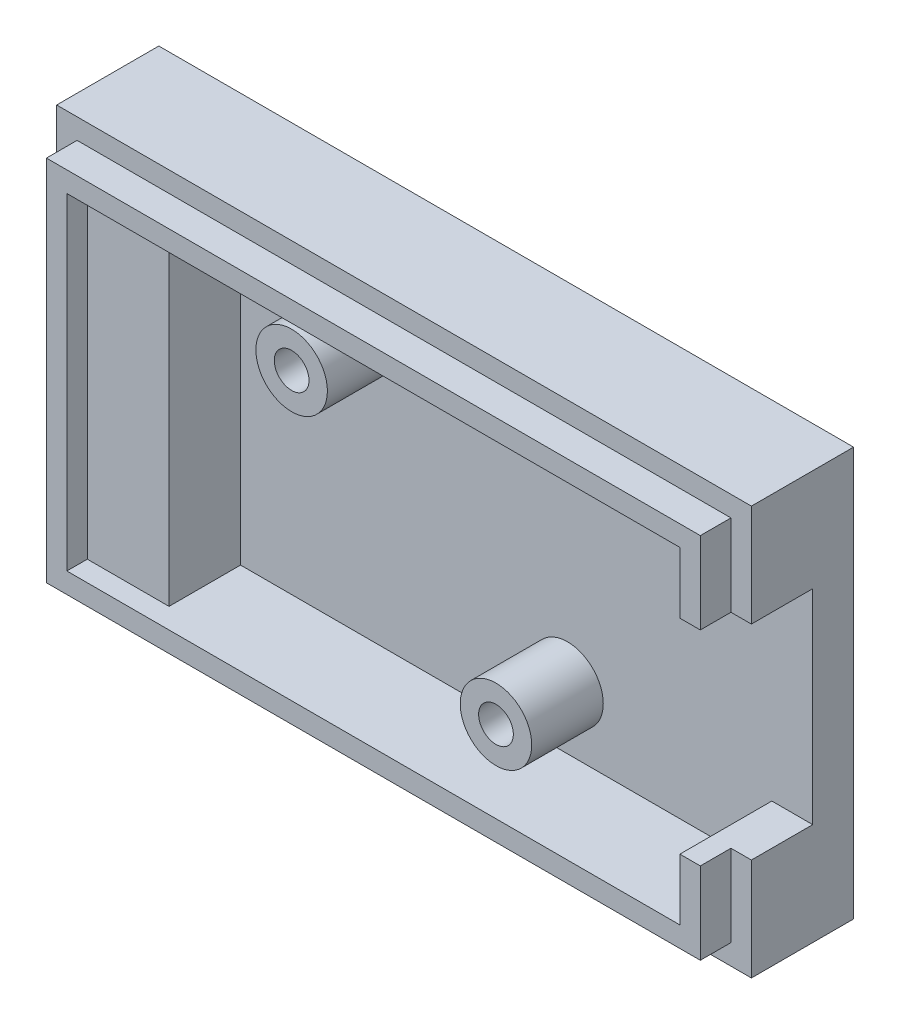
from build123d import *

# Parameters (mm, degrees)
SKETCH_1_W          = 34
SKETCH_1_H          = 20
EXTRUDE_1_DEPTH     = 6.5
SKETCH_2_W          = 30
SKETCH_2_H          = 16
CUT_EXTRUDE_1_DEPTH = 4.5
SKETCH_3_W          = 4.5
SKETCH_3_H          = 10
CUT_EXTRUDE_2_DEPTH = 2
CUT_EXTRUDE_3_DEPTH = 1.5
SKETCH_5_W          = 4
SKETCH_5_H          = 16
EXTRUDE_2_DEPTH     = 3.5
SKETCH_6_R          = 1.75
EXTRUDE_3_DEPTH     = 3.5
SKETCH_7_R          = 0.85
CUT_EXTRUDE_4_DEPTH = 21.475595229
SKETCH_8_R          = 1.5
CUT_EXTRUDE_5_DEPTH = 1


with BuildPart() as part:
    # 草图1 → 凸台-拉伸1 (new body)
    with BuildSketch(Plane.XY):
        Rectangle(SKETCH_1_W, SKETCH_1_H)
    extrude(amount=EXTRUDE_1_DEPTH)

    # 草图2 → 切除-拉伸1 (cut)
    with BuildSketch(Plane.XY.offset(6.5)):
        Rectangle(SKETCH_2_W, SKETCH_2_H)
    extrude(amount=-CUT_EXTRUDE_1_DEPTH, mode=Mode.SUBTRACT)

    # 草图3 → 切除-拉伸2 (cut)
    with BuildSketch(Plane(origin=(17, 0, 0), x_dir=(0, 0, -1), z_dir=(1, 0, 0))):
        with Locations((-4.25, 0)):
            Rectangle(SKETCH_3_W, SKETCH_3_H)
    extrude(amount=-CUT_EXTRUDE_2_DEPTH, mode=Mode.SUBTRACT)

    # 草图4 → 切除-拉伸3 (cut)
    with BuildSketch(Plane.XY.offset(6.5)):
        Polygon((16, 5), (16, 9), (-16, 9), (-16, -9), (16, -9), (16, -5), (17, -5), (17, -10), (-17, -10), (-17, 10), (17, 10), (17, 5), align=None)
    extrude(amount=-CUT_EXTRUDE_3_DEPTH, mode=Mode.SUBTRACT)

    # 草图5 → 凸台-拉伸2 (add)
    with BuildSketch(Plane.XY.offset(2)):
        with Locations((-13, 0)):
            Rectangle(SKETCH_5_W, SKETCH_5_H)
    extrude(amount=EXTRUDE_2_DEPTH)

    # 草图6 → 凸台-拉伸3 (add)
    with BuildSketch(Plane.XY.offset(2)):
        with Locations((-5, 5)):
            Circle(SKETCH_6_R)
        with Locations((5, -5)):
            Circle(SKETCH_6_R)
    extrude(amount=EXTRUDE_3_DEPTH)

    # 草图7 → 切除-拉伸4 (cut, through all)
    with BuildSketch(Plane.XY.offset(5.5)):
        with Locations((-5, 5)):
            Circle(SKETCH_7_R)
        with Locations((5, -5)):
            Circle(SKETCH_7_R)
    extrude(amount=-CUT_EXTRUDE_4_DEPTH, mode=Mode.SUBTRACT)

    # 草图8 → 切除-拉伸5 (cut)
    with BuildSketch(Plane(origin=(0, 0, 0), x_dir=(-1, 0, 0), z_dir=(0, 0, -1))):
        with Locations((-5, -5)):
            Circle(SKETCH_8_R)
        with Locations((5, 5)):
            Circle(SKETCH_8_R)
    extrude(amount=-CUT_EXTRUDE_5_DEPTH, mode=Mode.SUBTRACT)


solid = part.part
